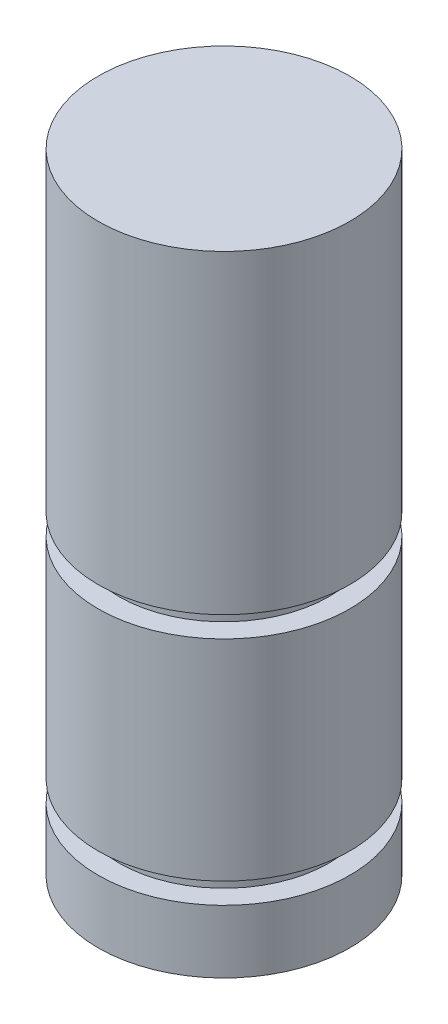
from build123d import *

# Parameters (mm, degrees)
SKETCH1_R           = 6
BOSS_EXTRUDE1_DEPTH = 30
SKETCH2_R           = 2.1
CUT_EXTRUDE1_DEPTH  = 10
SKETCH3_R           = 6
SKETCH3_R_2         = 5
CUT_EXTRUDE2_DEPTH  = 1
CUT_EXTRUDE3_START  = 1
SKETCH4_R           = 6
SKETCH4_R_2         = 5
CUT_EXTRUDE3_DEPTH  = 1


with BuildPart() as part:
    # Sketch1 → Boss-Extrude1 (new body)
    with BuildSketch(Plane(origin=(0, 0, 0), x_dir=(1, 0, 0), z_dir=(0, 1, 0))):
        Circle(SKETCH1_R)
    extrude(amount=BOSS_EXTRUDE1_DEPTH)

    # Sketch2 → Cut-Extrude1 (cut)
    with BuildSketch(Plane.XZ):
        Circle(SKETCH2_R)
    extrude(amount=-CUT_EXTRUDE1_DEPTH, mode=Mode.SUBTRACT)

    # Sketch3 → Cut-Extrude2 (cut)
    with BuildSketch(Plane(origin=(0, 14, 0), x_dir=(-1, 0, 0), z_dir=(0, -1, 0))):
        Circle(SKETCH3_R)
        Circle(SKETCH3_R_2, mode=Mode.SUBTRACT)
    extrude(amount=-CUT_EXTRUDE2_DEPTH, mode=Mode.SUBTRACT)

    # Sketch4 → Cut-Extrude3 (cut)
    with BuildSketch(Plane(origin=(0, 4, 0), x_dir=(-1, 0, 0), z_dir=(0, -1, 0)).offset(CUT_EXTRUDE3_START)):
        Circle(SKETCH4_R)
        Circle(SKETCH4_R_2, mode=Mode.SUBTRACT)
    extrude(amount=-CUT_EXTRUDE3_DEPTH, mode=Mode.SUBTRACT)


solid = part.part
